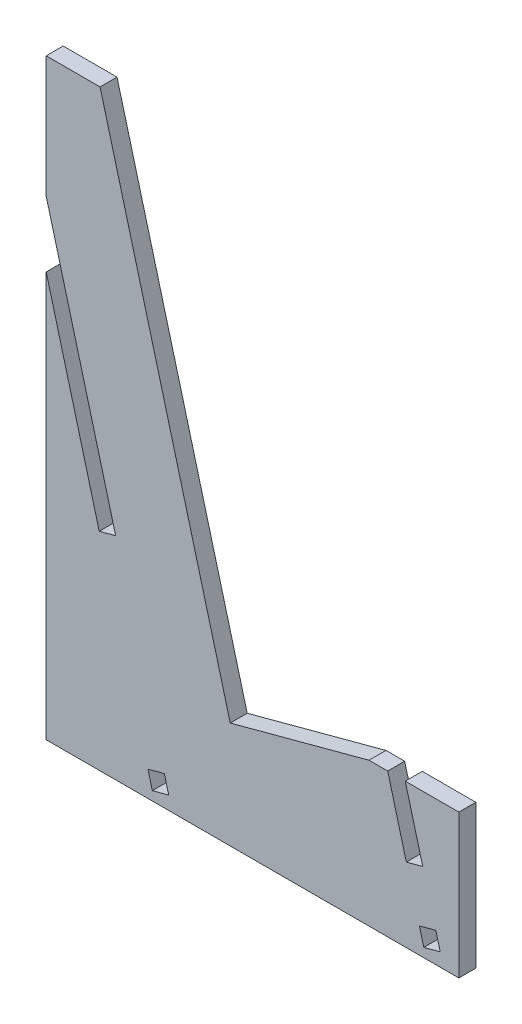
from build123d import *

# Parameters (mm, degrees)
BOSS_EXTRUDE1_DEPTH = 3
CUT_EXTRUDE1_DEPTH  = 92.894682084
CUT_EXTRUDE2_DEPTH  = 92.894682084


with BuildPart() as part:
    # Sketch1 → Boss-Extrude1 (new body)
    with BuildSketch(Plane.XY):
        Polygon((-38.029024976, 83.602786166), (-38.029024976, -21.094016045), (34.914504121, -21.094016045), (34.914504121, 4.305983955), (19.039504121, 4.305983955), (-5.495011867, -2.268019791), (-28.504024976, 83.602786166), align=None)
    extrude(amount=BOSS_EXTRUDE1_DEPTH)

    # Sketch2 → Cut-Extrude1 (cut, through all)
    with BuildSketch(Plane.XY.offset(3)):
        Polygon((-20.041101342, -16.608738567), (-19.264644206, -19.506516045), (-16.366866727, -18.73005891), (-17.143323863, -15.832281431), align=None)
        Polygon((-38.029024976, 50.523106361), (-28.646834591, 15.508295158), (-25.749057112, 16.284752293), (-38.029024976, 62.114216276), align=None)
    extrude(amount=-CUT_EXTRUDE1_DEPTH, mode=Mode.SUBTRACT)

    # Sketch3 → Cut-Extrude2 (cut, through all)
    with BuildSketch(Plane.XY.offset(3)):
        Polygon((28.718385454, -19.506516045), (31.616162933, -18.73005891), (30.839705798, -15.832281431), (27.941928319, -16.608738567), align=None)
        Polygon((25.632140913, -7.988494613), (28.529918392, -7.212037478), (25.443673851, 4.305983955), (22.337845309, 4.305983955), (22.545896372, 3.529526819), align=None)
    extrude(amount=-CUT_EXTRUDE2_DEPTH, mode=Mode.SUBTRACT)


solid = part.part
